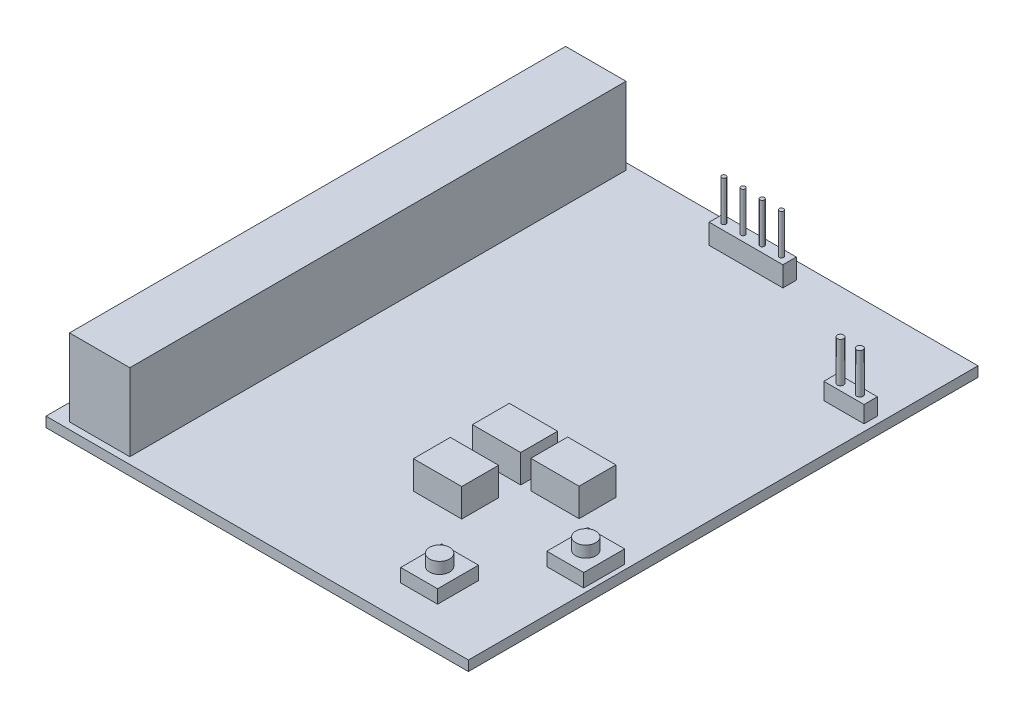
from build123d import *

# Parameters (mm, degrees)
SKETCH1_W            = 63
SKETCH1_H            = 76
BOSS_EXTRUDE1_DEPTH  = 1.5
SKETCH2_W            = 9
SKETCH2_H            = 74
BOSS_EXTRUDE2_DEPTH  = 11.5
SKETCH3_W            = 7
SKETCH3_H            = 8
BOSS_EXTRUDE3_DEPTH  = 3.5
SKETCH4_W            = 11
SKETCH4_H            = 2
BOSS_EXTRUDE4_DEPTH  = 3
SKETCH5_R            = 0.325
BOSS_EXTRUDE5_DEPTH  = 6
SKETCH6_W            = 6
SKETCH6_H            = 2
BOSS_EXTRUDE6_DEPTH  = 2.5
SKETCH7_R            = 0.473098864
BOSS_EXTRUDE7_DEPTH  = 6
SKETCH8_W            = 7.2
SKETCH8_H            = 5.5
BOSS_EXTRUDE8_DEPTH  = 4.2
SKETCH9_W            = 5.5
SKETCH9_H            = 6.1
BOSS_EXTRUDE9_DEPTH  = 2
SKETCH10_R           = 1.5
BOSS_EXTRUDE10_DEPTH = 1.7
SKETCH11_W           = 5.5
SKETCH11_H           = 6.1
BOSS_EXTRUDE11_DEPTH = 2
SKETCH12_R           = 1.5
BOSS_EXTRUDE12_DEPTH = 1.7


with BuildPart() as part:
    # Sketch1 → Boss-Extrude1 (new body)
    with BuildSketch(Plane(origin=(0, 0, 0), x_dir=(1, 0, 0), z_dir=(0, 1, 0))):
        with Locations((31.5, 38)):
            Rectangle(SKETCH1_W, SKETCH1_H)
    extrude(amount=BOSS_EXTRUDE1_DEPTH)

    # Sketch2 → Boss-Extrude2 (add)
    with BuildSketch(Plane(origin=(0, 1.5, 0), x_dir=(1, 0, 0), z_dir=(0, 1, 0))):
        with Locations((7, 38)):
            Rectangle(SKETCH2_W, SKETCH2_H)
    extrude(amount=BOSS_EXTRUDE2_DEPTH)

    # Sketch3 → Boss-Extrude3 (add)
    with BuildSketch(Plane.XZ):
        with Locations((12.5, -19)):
            Rectangle(SKETCH3_W, SKETCH3_H)
        with Locations((12.5, -38)):
            Rectangle(SKETCH3_W, SKETCH3_H)
        with Locations((12.5, -60)):
            Rectangle(SKETCH3_W, SKETCH3_H)
    extrude(amount=BOSS_EXTRUDE3_DEPTH)

    # Sketch4 → Boss-Extrude4 (add)
    with BuildSketch(Plane(origin=(0, 1.5, 0), x_dir=(1, 0, 0), z_dir=(0, 1, 0))):
        with Locations((32.9, 72.5)):
            Rectangle(SKETCH4_W, SKETCH4_H)
    extrude(amount=BOSS_EXTRUDE4_DEPTH)

    # Sketch5 → Boss-Extrude5 (add)
    with BuildSketch(Plane(origin=(0, 4.5, 0), x_dir=(1, 0, 0), z_dir=(0, 1, 0))):
        with Locations((28.6, 72.5)):
            Circle(SKETCH5_R)
        with Locations((31.46, 72.5)):
            Circle(SKETCH5_R)
        with Locations((34.32, 72.5)):
            Circle(SKETCH5_R)
        with Locations((37.18, 72.5)):
            Circle(SKETCH5_R)
    extrude(amount=BOSS_EXTRUDE5_DEPTH)

    # Sketch6 → Boss-Extrude6 (add)
    with BuildSketch(Plane(origin=(0, 1.5, 0), x_dir=(1, 0, 0), z_dir=(0, 1, 0))):
        with Locations((59, 61)):
            Rectangle(SKETCH6_W, SKETCH6_H)
    extrude(amount=BOSS_EXTRUDE6_DEPTH)

    # Sketch7 → Boss-Extrude7 (add)
    with BuildSketch(Plane(origin=(0, 4, 0), x_dir=(1, 0, 0), z_dir=(0, 1, 0))):
        with Locations((57.5, 60.988988549)):
            Circle(SKETCH7_R)
        with Locations((60.4, 60.988988549)):
            Circle(SKETCH7_R)
    extrude(amount=BOSS_EXTRUDE7_DEPTH)

    # Sketch8 → Boss-Extrude8 (add)
    with BuildSketch(Plane(origin=(0, 1.5, 0), x_dir=(1, 0, 0), z_dir=(0, 1, 0))):
        with Locations((40.7, 29.25)):
            Rectangle(SKETCH8_W, SKETCH8_H)
        with Locations((49.4, 29.25)):
            Rectangle(SKETCH8_W, SKETCH8_H)
        with Locations((40.7, 20.45)):
            Rectangle(SKETCH8_W, SKETCH8_H)
    extrude(amount=BOSS_EXTRUDE8_DEPTH)

    # Sketch9 → Boss-Extrude9 (add)
    with BuildSketch(Plane(origin=(0, 1.5, 0), x_dir=(1, 0, 0), z_dir=(0, 1, 0))):
        with Locations((59.55, 20.95)):
            Rectangle(SKETCH9_W, SKETCH9_H)
    extrude(amount=BOSS_EXTRUDE9_DEPTH)

    # Sketch10 → Boss-Extrude10 (add)
    with BuildSketch(Plane(origin=(0, 3.5, 0), x_dir=(1, 0, 0), z_dir=(0, 1, 0))):
        with Locations((59.55, 20.95)):
            Circle(SKETCH10_R)
    extrude(amount=BOSS_EXTRUDE10_DEPTH)

    # Sketch11 → Boss-Extrude11 (add)
    with BuildSketch(Plane(origin=(0, 1.5, 0), x_dir=(1, 0, 0), z_dir=(0, 1, 0))):
        with Locations((50.75, 7.95)):
            Rectangle(SKETCH11_W, SKETCH11_H)
    extrude(amount=BOSS_EXTRUDE11_DEPTH)

    # Sketch12 → Boss-Extrude12 (add)
    with BuildSketch(Plane(origin=(0, 3.5, 0), x_dir=(1, 0, 0), z_dir=(0, 1, 0))):
        with Locations((50.75, 7.95)):
            Circle(SKETCH12_R)
    extrude(amount=BOSS_EXTRUDE12_DEPTH)


solid = part.part
